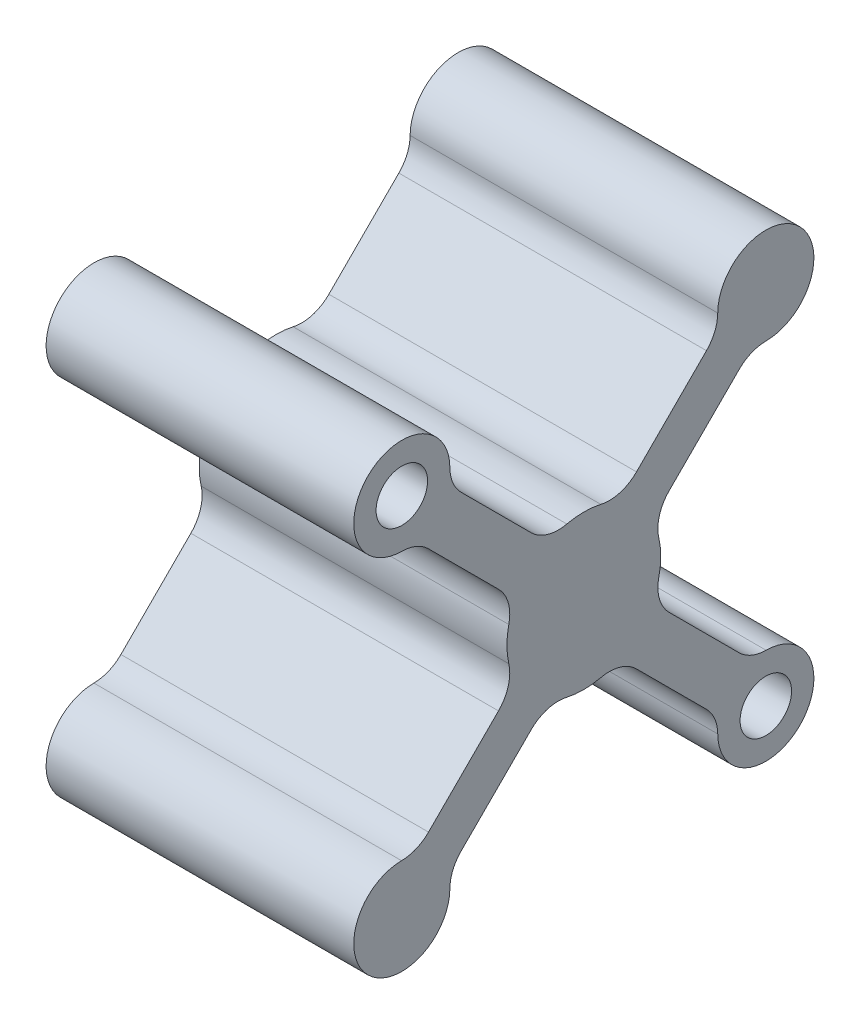
from build123d import *

# Parameters (mm, degrees)
BOSS_EXTRUDE1_DEPTH  = 20.32
M3_CLEARANCE_HOLE1_D = 3.4


with BuildPart() as part:
    # Sketch2 → Boss-Extrude1 (new body)
    with BuildSketch(Plane.YZ):
        with BuildLine():
            Line((-3.48023631, 5.63549778), (-8.101958691, 10.25722016))
            ThreePointArc((-8.101958691, 10.25722016), (-8.649791918, 11.074595912), (-8.845866506, 12.038846461))
            ThreePointArc((-8.845866506, 12.038846461), (-14.265879336, 14.265879336), (-12.038846461, 8.845866506))
            ThreePointArc((-12.038846461, 8.845866506), (-11.074595912, 8.649791918), (-10.25722016, 8.101958691))
            Line((-10.25722016, 8.101958691), (-5.63549778, 3.48023631))
            ThreePointArc((-5.63549778, 3.48023631), (-4.991360303, 2.389223457), (-4.954366003, 1.122790058))
            ThreePointArc((-4.954366003, 1.122790058), (-5.08, 0), (-4.954366003, -1.122790058))
            ThreePointArc((-4.954366003, -1.122790058), (-4.991360303, -2.389223457), (-5.63549778, -3.48023631))
            Line((-5.63549778, -3.48023631), (-10.25722016, -8.101958691))
            ThreePointArc((-10.25722016, -8.101958691), (-11.074595912, -8.649791918), (-12.038846461, -8.845866506))
            ThreePointArc((-12.038846461, -8.845866506), (-14.265879336, -14.265879336), (-8.845866506, -12.038846461))
            ThreePointArc((-8.845866506, -12.038846461), (-8.649791918, -11.074595912), (-8.101958691, -10.25722016))
            Line((-8.101958691, -10.25722016), (-3.48023631, -5.63549778))
            ThreePointArc((-3.48023631, -5.63549778), (-2.389223457, -4.991360303), (-1.122790058, -4.954366003))
            ThreePointArc((-1.122790058, -4.954366003), (0, -5.08), (1.122790058, -4.954366003))
            ThreePointArc((1.122790058, -4.954366003), (2.389223457, -4.991360303), (3.48023631, -5.63549778))
            Line((3.48023631, -5.63549778), (8.101958691, -10.25722016))
            ThreePointArc((8.101958691, -10.25722016), (8.649791918, -11.074595912), (8.845866506, -12.038846461))
            ThreePointArc((8.845866506, -12.038846461), (14.265879336, -14.265879336), (12.038846461, -8.845866506))
            ThreePointArc((12.038846461, -8.845866506), (11.074595912, -8.649791918), (10.25722016, -8.101958691))
            Line((10.25722016, -8.101958691), (5.63549778, -3.48023631))
            ThreePointArc((5.63549778, -3.48023631), (4.991360303, -2.389223457), (4.954366003, -1.122790058))
            ThreePointArc((4.954366003, -1.122790058), (5.08, 0), (4.954366003, 1.122790058))
            ThreePointArc((4.954366003, 1.122790058), (4.991360303, 2.389223457), (5.63549778, 3.48023631))
            Line((5.63549778, 3.48023631), (10.25722016, 8.101958691))
            ThreePointArc((10.25722016, 8.101958691), (11.074595912, 8.649791918), (12.038846461, 8.845866506))
            ThreePointArc((12.038846461, 8.845866506), (14.265879336, 14.265879336), (8.845866506, 12.038846461))
            ThreePointArc((8.845866506, 12.038846461), (8.649791918, 11.074595912), (8.101958691, 10.25722016))
            Line((8.101958691, 10.25722016), (3.48023631, 5.63549778))
            ThreePointArc((3.48023631, 5.63549778), (2.389223457, 4.991360303), (1.122790058, 4.954366003))
            ThreePointArc((1.122790058, 4.954366003), (0, 5.08), (-1.122790058, 4.954366003))
            ThreePointArc((-1.122790058, 4.954366003), (-2.389223457, 4.991360303), (-3.48023631, 5.63549778))
        make_face()
    extrude(amount=BOSS_EXTRUDE1_DEPTH)

    # M3 Clearance Hole1 (through all)
    with Locations(Plane(origin=(20.32, 0, 0), x_dir=(0, 0, -1), z_dir=(1, 0, 0))):
        with Locations((-12.020815306, 12.020815306), (12.020815306, -12.020815306)):
            Hole(M3_CLEARANCE_HOLE1_D / 2)


solid = part.part
